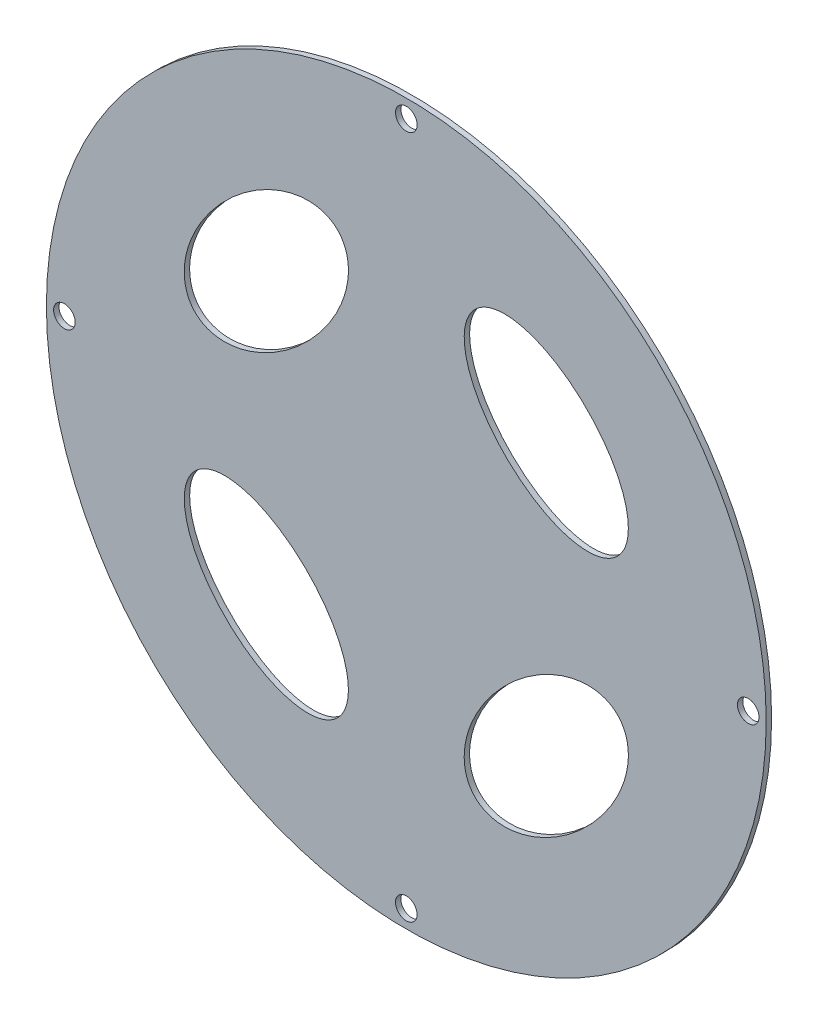
from build123d import *

# Parameters (mm, degrees)
SKETCH1_R           = 100
BASE_DISC_DEPTH     = 1.5
SKETCH2_R           = 20
SKETCH2_R_2         = 3
BOSS_EXTRUDE2_DEPTH = 8
SKETCH3_R           = 3
CUT_EXTRUDE1_DEPTH  = 142.647449677
CIRPATTERN1_COUNT   = 4
SKETCH4_RX          = 28
SKETCH4_RY          = 16
CUT_EXTRUDE2_DEPTH  = 142.647449677
CIRPATTERN2_COUNT   = 4


with BuildPart() as part:
    # Sketch1 → Base Disc (new body)
    with BuildSketch(Plane.XY):
        Circle(SKETCH1_R)
    extrude(amount=BASE_DISC_DEPTH)

    # Sketch2 → Boss-Extrude2 (add)
    with BuildSketch(Plane(origin=(0, 0, 0), x_dir=(-1, 0, 0), z_dir=(0, 0, -1))):
        Circle(SKETCH2_R)
        Circle(SKETCH2_R_2, mode=Mode.SUBTRACT)
    extrude(amount=BOSS_EXTRUDE2_DEPTH)

    # Sketch3 → Cut-Extrude1 (cut, through all)
    with BuildSketch(Plane(origin=(0, 0, 0), x_dir=(-1, 0, 0), z_dir=(0, 0, -1))):
        with Locations((95, 0)):
            Circle(SKETCH3_R)
    cut_extrude1 = extrude(amount=-CUT_EXTRUDE1_DEPTH, mode=Mode.SUBTRACT)

    # CirPattern1: Cut-Extrude1 ×4 about axis
    cirpattern1_axis = Axis((0, 0, 0), (0, 0, -1))
    for i in range(1, CIRPATTERN1_COUNT):
        add(cut_extrude1.rotate(cirpattern1_axis, i * 360 / CIRPATTERN1_COUNT), mode=Mode.SUBTRACT)

    # Sketch4 → Cut-Extrude2 (cut, through all)
    with BuildSketch(Plane(origin=(0, 0, 0), x_dir=(-1, 0, 0), z_dir=(0, 0, -1))):
        with Locations(Location((38.890872965, 38.890872965), (0, 0, 135))):
            Ellipse(SKETCH4_RX, SKETCH4_RY)
    cut_extrude2 = extrude(amount=-CUT_EXTRUDE2_DEPTH, mode=Mode.SUBTRACT)

    # CirPattern2: Cut-Extrude2 ×4 about axis
    cirpattern2_axis = Axis((0, 0, -8), (0, 0, -1))
    for i in range(1, CIRPATTERN2_COUNT):
        add(cut_extrude2.rotate(cirpattern2_axis, i * 360 / CIRPATTERN2_COUNT), mode=Mode.SUBTRACT)


solid = part.part
